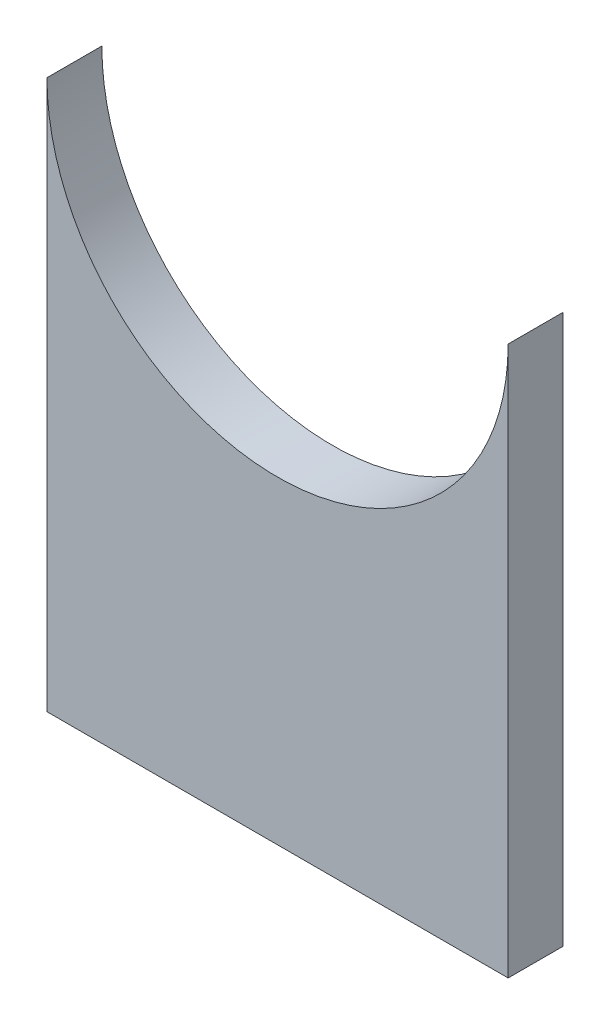
from build123d import *

# Parameters (mm, degrees)
BOSS_EXTRUDE1_DEPTH = 6.35


with BuildPart() as part:
    # Sketch1 → Boss-Extrude1 (new body)
    with BuildSketch(Plane.XY):
        with BuildLine():
            Line((-26.67, -63.5), (26.67, -63.5))
            Line((26.67, -63.5), (26.67, 0))
            ThreePointArc((26.67, 0), (0, -26.67), (-26.67, 0))
            Line((-26.67, 0), (-26.67, -63.5))
        make_face()
    extrude(amount=BOSS_EXTRUDE1_DEPTH)


solid = part.part
